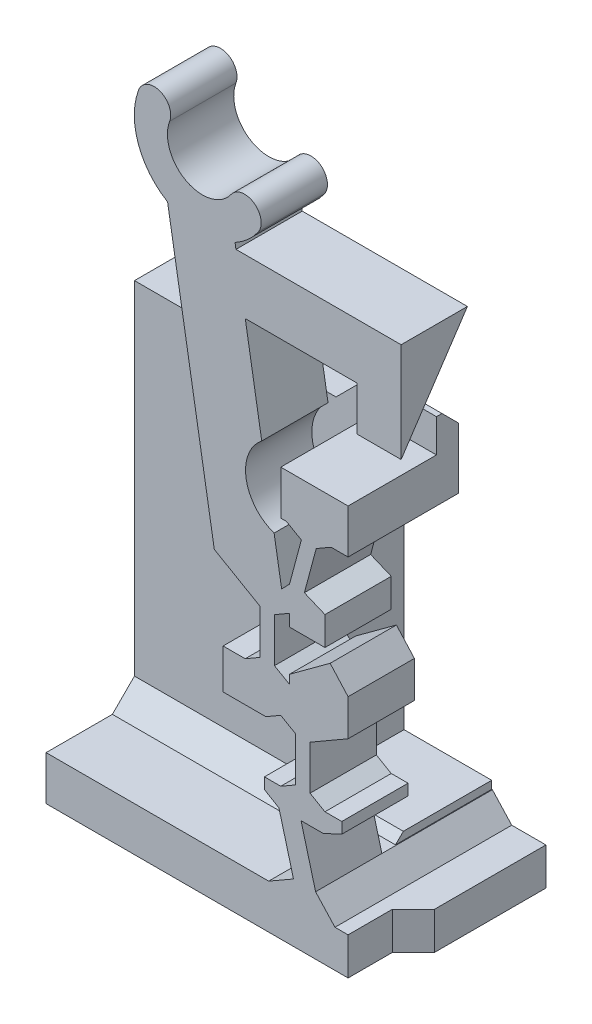
from build123d import *

# Parameters (mm, degrees)
BOSS_SWITCH_BODY_DEPTH                    = 3
SKETCH1_W                                 = 4
SKETCH1_H                                 = 3.5
BOSS_FLANGE_WIDTH_DEPTH                   = 5
BOSS_FLANGE_HEIGHT_REACH                  = 35.863
SKETCH2_W                                 = 4
SKETCH2_H                                 = 2
SKETCH2_W_2                               = 8
CUT_UP_TO_DOWN_DERAILLEUR_CLEARANCE_REACH = 21.462
SKETCH10_W                                = 2.453096586
SKETCH10_H                                = 3
SKETCH17_W                                = 12.1675
SKETCH17_H                                = 4
BOSS_FLANGE_SUPPORT_DEPTH                 = 14.499999955
TAP_DRILL_FOR_M2X0_4_TAP1_D               = 1.6
M2_CLEARANCE_HOLE2_D                      = 2.4
M2_CLEARANCE_HOLE2_DEPTH                  = 15
M2_CLEARANCE_HOLE2_TIP                    = 0.721032743
CHAMFER_FLANGE_SUPPORT_SIZE               = 1.5
CHAMFER_FLANGE_SUPPORT_2_SIZE             = 1.5
CHAMFER_FLANGE_SUPPORT_3_SIZE             = 1
SKETCH23_W                                = 3.9675
SKETCH23_H                                = 11.999999954
CUT_GAP_FOR_PRINTING_DEPTH                = 32.000499688
SKETCH25_W                                = 0.953096586
SKETCH25_H                                = 3.5
CUT_DERAILLEUR_CLEARANCE_DEPTH            = 32.145320369
CHAMFER8_SIZE                             = 1
CUT_UP_TO_DOWN_CANTILEVER_SLOPE_REACH     = 31.869
SKETCH26_W                                = 12.477246204
SKETCH26_H                                = 5.771077126
CUT_WIDE_DERAILLEUR_CLEARANCE_DEPTH       = 33.195879702
CUT_WIDE_DERAILLEUR_CLEARANCE_DEPTH_BACK  = 4
SKETCH27_W                                = 2.5
SKETCH27_H                                = 5.000000046
CHAMFER9_SIZE                             = 1.25
SKETCH28_W                                = 3.046903414
SKETCH28_H                                = 1.5
CUT_EXTRUDE1_DEPTH                        = 1


# Some blends are built 0.0001 mm under size
with BuildPart() as part:
    # Sketch-SwitchBossUp → Boss-Switch Body (new body)
    with BuildSketch(Plane.XY):
        with BuildLine():
            Line((5.581091201, 12.55524379), (5.581100766, 11.263016279))
            Line((5.581100766, 11.263016279), (3.971265023, 11.263016279))
            Line((3.971265023, 11.263016279), (3.97126394, 11.79911022))
            Line((3.97126394, 11.79911022), (3.296271341, 11.409403061))
            Line((3.296271341, 11.409403061), (3.296271341, 9.409403061))
            Line((3.296271341, 9.409403061), (3.971278743, 9.019687356))
            Line((3.971278743, 9.019687356), (3.971278743, 9.409408058))
            Line((3.971278743, 9.409408058), (5.815189336, 10.763016279))
            Line((5.815189336, 10.763016279), (6.627976927, 9.860324207))
            Line((6.627976927, 9.860324207), (6.627976927, 8.210536506))
            Line((6.627976927, 8.210536506), (5.581127833, 7.606137899))
            Line((5.581127833, 7.606137899), (4.906138119, 7.216432406))
            Line((4.906138119, 7.216432406), (4.906138119, 5.216432406))
            Line((4.906138119, 5.216432406), (5.58114552, 4.826716701))
            Line((5.58114552, 4.826716701), (6.342350466, 4.826716701))
            Line((6.342350466, 4.826716701), (6.342350466, 4.326716701))
            Line((6.342350466, 4.326716701), (5.499190584, 3.937018274))
            Line((5.499190584, 3.937018274), (4.499190584, 3.937018274))
            Line((4.499190584, 3.937018274), (5.157616583, 1.479738993))
            Line((5.157616583, 1.479738993), (6.034464198, 0.526482161))
            Line((6.034464198, 0.526482161), (6.627976927, 0.526482161))
            Line((6.627976927, 0.526482161), (6.627976927, -1.165310653))
            Line((6.627976927, -1.165310653), (3.034464198, -1.165310653))
            Line((3.034464198, -1.165310653), (3.034464198, 0.834689347))
            Line((3.034464198, 0.834689347), (4.157616583, 1.479738993))
            Line((4.157616583, 1.479738993), (3.499190584, 3.937018274))
            Line((3.499190584, 3.937018274), (2.842350466, 4.326720436))
            Line((2.842350466, 4.326720436), (2.842350466, 4.826720436))
            Line((2.842350466, 4.826720436), (3.58114552, 4.826720436))
            Line((3.58114552, 4.826720436), (4.256138119, 5.216427595))
            Line((4.256138119, 5.216427595), (4.256138119, 7.216427595))
            Line((4.256138119, 7.216427595), (3.581130717, 7.6061433))
            Line((3.581130717, 7.6061433), (2.9061262, 7.216422599))
            Line((2.9061262, 7.216422599), (0.971281627, 7.216422599))
            Line((0.971281627, 7.216422599), (0.971281627, 9.019692757))
            Line((0.971281627, 9.019692757), (1.971281627, 9.019692757))
            Line((1.971281627, 9.019692757), (2.646271341, 9.40939825))
            Line((2.646271341, 9.40939825), (2.646271341, 11.40939825))
            Line((2.646271341, 11.40939825), (1.696557212, 11.957715958))
            Line((1.696557212, 11.957715958), (0.573317845, 12.60621851))
            Line((0.573317845, 12.60621851), (-1.541303694, 25.167805745))
            ThreePointArc((-1.541303694, 25.167805745), (-2.872284003, 26.795385437), (-2.852546321, 28.897797067))
            ThreePointArc((-2.852546321, 28.897797067), (-1.887813913, 29.338582026), (-1.447028953, 28.373849618))
            ThreePointArc((-1.447028953, 28.373849618), (-0.703448682, 26.416936722), (1.333779254, 26.898727173))
            ThreePointArc((1.333779254, 26.898727173), (2.379722745, 27.074801628), (2.555797201, 26.028858137))
            ThreePointArc((2.555797201, 26.028858137), (2.086504637, 25.507104397), (1.511513111, 25.104801997))
            Line((1.511513111, 25.104801997), (1.553598189, 24.854801997))
            Line((1.553598189, 24.854801997), (9.027976927, 24.854801997))
            Line((9.027976927, 24.854801997), (9.027976927, 22.354801997))
            Line((9.027976927, 22.354801997), (9.027976927, 20.354801997))
            Line((9.027976927, 20.354801997), (7.027976927, 20.354801997))
            Line((7.027976927, 20.354801997), (7.027976927, 22.354801997))
            Line((7.027976927, 22.354801997), (1.974448974, 22.354801997))
            Line((1.974448974, 22.354801997), (2.719778232, 17.927287042))
            ThreePointArc((2.719778232, 17.927287042), (2.013826204, 16.096957693), (3.280124137, 14.598637521))
            Line((3.280124137, 14.598637521), (3.620297651, 12.577888564))
            Line((3.620297651, 12.577888564), (3.976674365, 12.944956135))
            Line((3.976674365, 12.944956135), (4.512557947, 14.944960101))
            Line((4.512557947, 14.944960101), (3.837515632, 15.334689301))
            Line((3.837515632, 15.334689301), (3.581073513, 15.334689301))
            Line((3.581073513, 15.334689301), (3.581073513, 17.334689301))
            Line((3.581073513, 17.334689301), (5.725580434, 17.334689301))
            Line((5.725580434, 17.334689301), (6.627976927, 17.334689301))
            Line((6.627976927, 17.334689301), (6.627976927, 15.334689301))
            Line((6.627976927, 15.334689301), (5.860498075, 15.334689301))
            Line((5.860498075, 15.334689301), (5.185487464, 14.944965082))
            Line((5.185487464, 14.944965082), (4.649603883, 12.944961115))
            Line((4.649603883, 12.944961115), (5.581091201, 12.55524379))
        make_face()
    extrude(amount=BOSS_SWITCH_BODY_DEPTH)

    # Sketch1 → Boss-Flange Width (add)
    with BuildSketch(Plane(origin=(0, 0, 0), x_dir=(-1, 0, 0), z_dir=(0, 0, -1))):
        Polygon((-7.581073513, -1.165310653), (0.412170615, -1.165310653), (0.412170615, 0.834689347), (-3.034464198, 0.834689347), (-4.157616583, 1.479738993), (-5.157616583, 1.479738993), (-6.034464198, 0.526482161), (-7.581073513, 0.526482161), align=None)
        with Locations((-5.581073513, 17.084689301)):
            Rectangle(SKETCH1_W, SKETCH1_H)
    extrude(amount=BOSS_FLANGE_WIDTH_DEPTH)

    # Sketch2 → Boss-Flange Height (add, up to next)
    with BuildSketch(Plane(origin=(-7.039523073, 0, 0), x_dir=(0, 0, -1), z_dir=(1, 0, 0)), mode=Mode.PRIVATE) as boss_flange_height_sk1:
        with Locations((3, 16.334689301)):
            Rectangle(SKETCH2_W, SKETCH2_H)
    boss_flange_height_tool1 = extrude(boss_flange_height_sk1.sketch, amount=BOSS_FLANGE_HEIGHT_REACH, mode=Mode.PRIVATE) - part.part
    # Sketch2 → Boss-Flange Height (add, up to next)
    with BuildSketch(Plane(origin=(-7.039523073, 0, 0), x_dir=(0, 0, -1), z_dir=(1, 0, 0)), mode=Mode.PRIVATE) as boss_flange_height_sk2:
        with Locations((1, -0.165310653)):
            Rectangle(SKETCH2_W_2, SKETCH2_H)
    boss_flange_height_tool2 = extrude(boss_flange_height_sk2.sketch, amount=BOSS_FLANGE_HEIGHT_REACH, mode=Mode.PRIVATE) - part.part
    add(boss_flange_height_tool1.solids().sort_by_distance((-7.039523, 16.334689, -3))[0])
    add(boss_flange_height_tool2.solids().sort_by_distance((-7.039523, -0.165311, -1))[0])

    # Sketch10 → Cut-Up-To-Down Derailleur Clearance (cut, up to next)
    with BuildSketch(Plane(origin=(0, 15.334689301, 0), x_dir=(1, 0, 0), z_dir=(0, 1, 0)), mode=Mode.PRIVATE) as cut_up_to_down_derailleur_clearance_sk1:
        with Locations((6.35452522, 3.5)):
            Rectangle(SKETCH10_W, SKETCH10_H)
    cut_up_to_down_derailleur_clearance_tool1 = extrude(cut_up_to_down_derailleur_clearance_sk1.sketch, amount=CUT_UP_TO_DOWN_DERAILLEUR_CLEARANCE_REACH, mode=Mode.PRIVATE) & part.part
    add(cut_up_to_down_derailleur_clearance_tool1.solids().sort_by_distance((6.354525, 15.334689, -3.5))[0], mode=Mode.SUBTRACT)

    # Sketch17 → Boss-Flange Support (add)
    with BuildSketch(Plane.XZ.offset(-15.334689301)):
        with Locations((-0.955773073, -3)):
            Rectangle(SKETCH17_W, SKETCH17_H)
    extrude(amount=BOSS_FLANGE_SUPPORT_DEPTH)

    # Tap Drill for M2x0.4 Tap1 (through all)
    with Locations(Plane(origin=(0, -1.165310653, 0), x_dir=(-1, 0, 0), z_dir=(0, -1, 0))):
        with Locations((5.039523073, 3), (0.539523073, 3)):
            Hole(TAP_DRILL_FOR_M2X0_4_TAP1_D / 2)

    # M2 Clearance Hole2
    with Locations(Plane.XZ.offset(1.165310653)):
        with Locations((-5.039523073, -3), (-0.539523073, -3)):
            Hole(M2_CLEARANCE_HOLE2_D / 2, depth=M2_CLEARANCE_HOLE2_DEPTH)
            with Locations((0, 0, -(M2_CLEARANCE_HOLE2_DEPTH + M2_CLEARANCE_HOLE2_TIP / 2))):  # 118° drill point
                Cone(0, M2_CLEARANCE_HOLE2_D / 2, M2_CLEARANCE_HOLE2_TIP, mode=Mode.SUBTRACT)

    # Chamfer-Flange Support
    chamfer_flange_support_edges = [part.edges().sort_by_distance(p)[0] for p in [
        (3.581073513, 17.334689301, -3),
    ]]
    chamfer(chamfer_flange_support_edges, length=CHAMFER_FLANGE_SUPPORT_SIZE - 0.0001)  # a hair under: the kernel refuses the full size

    # Chamfer-Flange Support 2
    chamfer_flange_support_2_edges = [part.edges().sort_by_distance(p)[0] for p in [
        (5.127976927, 17.084689301, -2),
        (5.127976927, 15.334689301, -1.5),
    ]]
    chamfer(chamfer_flange_support_2_edges, length=CHAMFER_FLANGE_SUPPORT_2_SIZE)

    # Chamfer-Flange Support 3
    chamfer_flange_support_3_edges = [part.edges().sort_by_distance(p)[0] for p in [
        (-2.002529437, 0.834689346, -1),
    ]]
    chamfer(chamfer_flange_support_3_edges, length=CHAMFER_FLANGE_SUPPORT_3_SIZE)

    # Sketch23 → Cut-Gap for Printing (cut, through all)
    with BuildSketch(Plane.XY.offset(-1)):
        with Locations((3.144226927, 7.834689324)):
            Rectangle(SKETCH23_W, SKETCH23_H)
    extrude(amount=-CUT_GAP_FOR_PRINTING_DEPTH, mode=Mode.SUBTRACT)

    # Sketch25 → Cut-Derailleur Clearance (cut, through all)
    with BuildSketch(Plane.XY):
        with Locations((7.10452522, 17.084689301)):
            Rectangle(SKETCH25_W, SKETCH25_H)
    extrude(amount=-CUT_DERAILLEUR_CLEARANCE_DEPTH, mode=Mode.SUBTRACT)

    # Chamfer8
    # the kernel refuses this chamfer: 1 mm, written as the material it adds along each edge
    with BuildSketch(Plane(origin=(6.627976927, 0.526482161, 0), x_dir=(0.9996219169112968, -3.148763632499715e-15, -0.027495876610586365), z_dir=(0, -1, 0))) as chamfer8_piece_1_section:
        Polygon((CHAMFER8_SIZE * 0.999621916911, CHAMFER8_SIZE * 0.0274958766106), (-CHAMFER8_SIZE * 0.0274958766106, CHAMFER8_SIZE * 0.999621916911), (0, 0), align=None)
    chamfer8_piece_1 = extrude(amount=1.691792814, mode=Mode.PRIVATE)
    chamfer8_piece_1 = split(chamfer8_piece_1, bisect_by=Plane(origin=(7.581073513, -0.319414246, 0.332375145), z_dir=(-1, 0, 0)), keep=Keep.TOP, mode=Mode.PRIVATE)
    add(chamfer8_piece_1)

    # Sketch26 → Cut-Up-to-Down Cantilever Slope (cut, up to next)
    with BuildSketch(Plane(origin=(-3.086642121, 5.589000146, 8.383500218), x_dir=(-0.9561404375276108, -0.1624764728289173, -0.24371470924337582), z_dir=(0.2929086269205964, -0.5303712883154423, -0.795556932473163)), mode=Mode.PRIVATE) as cut_up_to_down_cantilever_slope_sk1:
        with Locations((-13.791615152, 17.794906754)):
            Rectangle(SKETCH26_W, SKETCH26_H)
    cut_up_to_down_cantilever_slope_tool1 = extrude(cut_up_to_down_cantilever_slope_sk1.sketch, amount=CUT_UP_TO_DOWN_CANTILEVER_SLOPE_REACH, mode=Mode.PRIVATE) & part.part
    add(cut_up_to_down_cantilever_slope_tool1.solids().sort_by_distance((10.100079, 22.636071, 1.873881))[0], mode=Mode.SUBTRACT)

    # Sketch27 → Cut-Wide Derailleur Clearance (cut, two sides: drawn at the far end of the back side and taken through both)
    with BuildSketch(Plane(origin=(5.127976927, 0, 0), x_dir=(0, 0, -1), z_dir=(1, 0, 0)).offset(-CUT_WIDE_DERAILLEUR_CLEARANCE_DEPTH_BACK)):
        with Locations((3.75, 16.334689324)):
            Rectangle(SKETCH27_W, SKETCH27_H)
    extrude(amount=CUT_WIDE_DERAILLEUR_CLEARANCE_DEPTH + CUT_WIDE_DERAILLEUR_CLEARANCE_DEPTH_BACK, mode=Mode.SUBTRACT)

    # Chamfer9
    chamfer9_edges = [part.edges().sort_by_distance(p)[0] for p in [
        (4.85452522, 18.834689347, -2.5),
    ]]
    chamfer(chamfer9_edges, length=CHAMFER9_SIZE)

    # Sketch28 → Cut-Extrude1 (cut)
    with BuildSketch(Plane.XY.offset(-1)):
        with Locations((5.10452522, 18.084689301)):
            Rectangle(SKETCH28_W, SKETCH28_H)
    extrude(amount=CUT_EXTRUDE1_DEPTH, mode=Mode.SUBTRACT)


solid = part.part
